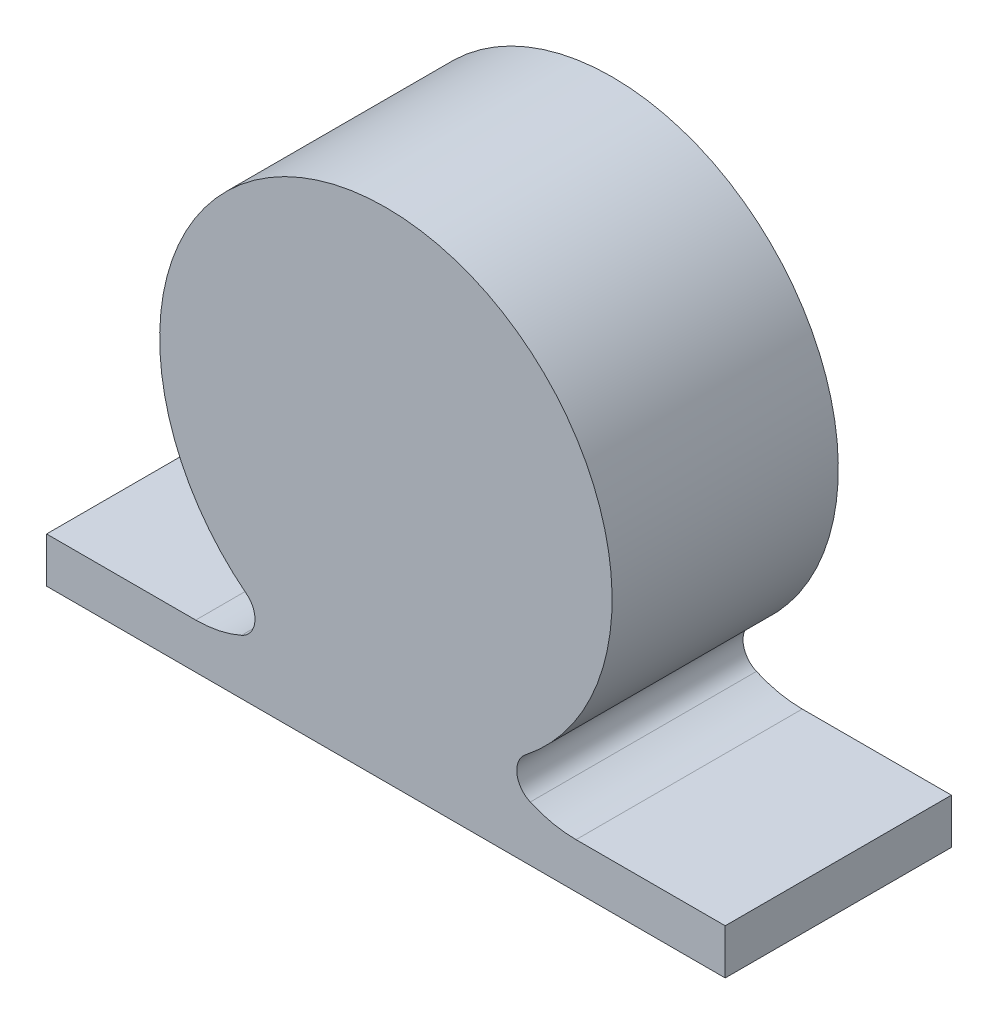
from build123d import *

# Parameters (mm, degrees)
SKETCH1_W           = 2.54
SKETCH1_H           = 1.016
SKETCH1_W_2         = 5.08
BOSS_EXTRUDE1_DEPTH = 5.08
FILLET1_R           = 2.54
FILLET2_R           = 0.508


with BuildPart() as part:
    # Sketch1 → Boss-Extrude1 (new body)
    with BuildSketch(Plane.XY):
        with BuildLine():
            Line((-2.54, -4.399409051), (-2.54, -1.651))
            Line((-2.54, -1.651), (2.54, -1.651))
            Line((2.54, -1.651), (2.54, -4.399409051))
            ThreePointArc((2.54, -4.399409051), (4.399409051, -2.54), (5.08, 0))
            ThreePointArc((5.08, 0), (-2.54, 4.399409051), (-2.54, -4.399409051))
        make_face()
        with BuildLine():
            Line((2.54, -1.651), (-2.54, -1.651))
            Line((-2.54, -1.651), (-2.54, -4.399409051))
            ThreePointArc((-2.54, -4.399409051), (-1.314800749, -4.906903198), (0, -5.08))
            ThreePointArc((0, -5.08), (1.314800749, -4.906903198), (2.54, -4.399409051))
            Line((2.54, -4.399409051), (2.54, -1.651))
        make_face()
        with BuildLine():
            Line((-2.54, -4.399409051), (-2.54, -1.651))
            Line((-2.54, -1.651), (2.54, -1.651))
            Line((2.54, -1.651), (2.54, -4.399409051))
            ThreePointArc((2.54, -4.399409051), (4.399409051, -2.54), (5.08, 0))
            ThreePointArc((5.08, 0), (-2.54, 4.399409051), (-2.54, -4.399409051))
        make_face()
        with BuildLine():
            Line((2.54, -1.651), (-2.54, -1.651))
            Line((-2.54, -1.651), (-2.54, -4.399409051))
            ThreePointArc((-2.54, -4.399409051), (-1.314800749, -4.906903198), (0, -5.08))
            ThreePointArc((0, -5.08), (1.314800749, -4.906903198), (2.54, -4.399409051))
            Line((2.54, -4.399409051), (2.54, -1.651))
        make_face()
        with BuildLine():
            ThreePointArc((0, -5.08), (-1.314800749, -4.906903198), (-2.54, -4.399409051))
            Line((-2.54, -4.399409051), (-2.54, -5.08))
            Line((-2.54, -5.08), (0, -5.08))
        make_face()
        with BuildLine():
            Line((2.54, -5.08), (2.54, -4.399409051))
            ThreePointArc((2.54, -4.399409051), (1.314800749, -4.906903198), (0, -5.08))
            Line((0, -5.08), (2.54, -5.08))
        make_face()
        with Locations((1.27, -5.588)):
            Rectangle(SKETCH1_W, SKETCH1_H)
        with Locations((-5.08, -5.588)):
            Rectangle(SKETCH1_W_2, SKETCH1_H)
        with Locations((5.08, -5.588)):
            Rectangle(SKETCH1_W_2, SKETCH1_H)
        with Locations((-1.27, -5.588)):
            Rectangle(SKETCH1_W, SKETCH1_H)
    extrude(amount=BOSS_EXTRUDE1_DEPTH)

    # Fillet1
    # the kernel refuses this fillet: 2.54 mm, written as the material it adds along each edge
    with BuildSketch(Plane(origin=(-2.54, -5.08, 0), x_dir=(-1, 0, 0), z_dir=(0, 0, 1))) as fillet1_piece_1:
        with BuildLine():
            CenterArc((1.730375098, -2.54), FILLET1_R, 90, 42.941402865)
            Line((0, -0.680590949), (-0.034607502, -0.643402768))
            ThreePointArc((-0.034607502, -0.643402768), (-0.0508, -0.340295474), (-0.0508, 0))
            Line((-0.0508, 0), (0, 0.0508))
            Line((0, 0.0508), (1.730375098, 0.0508))
            Line((1.730375098, 0.0508), (1.730375098, 0))
        make_face()
    extrude(amount=5.08)
    with BuildSketch(Plane(origin=(2.54, -5.08, 0), x_dir=(0, 1, 0), z_dir=(0, 0, 1))) as fillet1_piece_2:
        with BuildLine():
            CenterArc((2.54, -1.730375098), FILLET1_R, 137.058597135, 42.941402865)
            Line((0, -1.730375098), (-0.0508, -1.730375098))
            Line((-0.0508, -1.730375098), (-0.0508, 0))
            Line((-0.0508, 0), (0, 0.0508))
            ThreePointArc((0, 0.0508), (0.340295474, 0.0508), (0.643402768, 0.034607502))
            Line((0.643402768, 0.034607502), (0.680590949, 0))
        make_face()
    extrude(amount=5.08)

    # Fillet2
    fillet2_edges = [part.edges().sort_by_distance(p)[0] for p in [
        (2.54, -4.399409051, 2.54),
        (-2.54, -4.399409051, 2.54),
    ]]
    fillet(fillet2_edges, radius=FILLET2_R)


solid = part.part
